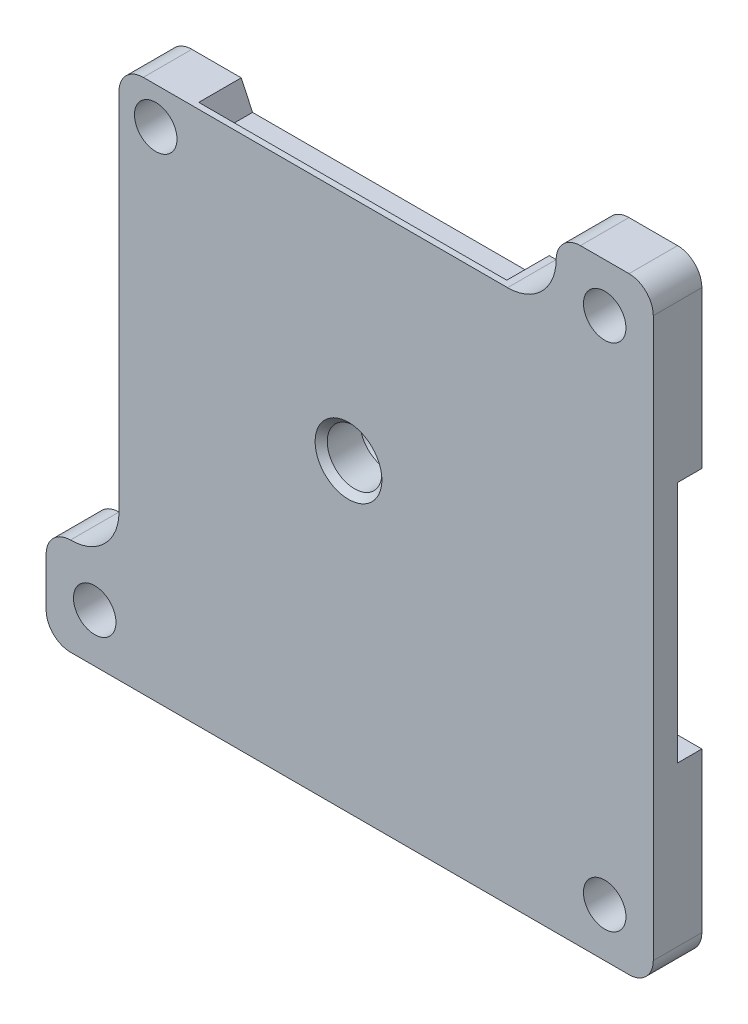
from build123d import *
from OCP.BRepFilletAPI import BRepFilletAPI_MakeChamfer

# Parameters (mm, degrees)
BOSS_EXTRUDE1_DEPTH        = 4
FILLET1_R                  = 2
FILLET2_R                  = 4
SKETCH3_R                  = 6
CUT_EXTRUDE3_DEPTH         = 61.942595941
SKETCH4_R                  = 1.75
CUT_EXTRUDE6_DEPTH         = 61.942595941
CUT_EXTRUDE7_DEPTH         = 10
CUT_EXTRUDE8_START         = -12.533
CUT_EXTRUDE8_DEPTH         = 25.3653
CHAMFER1_SIZE              = 2
CHAMFER1_SIZE_2            = 0.932615316
CHAMFER1_OF_MIRROR1_SIZE   = 0.932615316
CHAMFER1_OF_MIRROR1_SIZE_2 = 2
CHAMFER2_SIZE              = 0.5


with BuildPart() as part:
    # Sketch1 → Boss-Extrude1 (new body)
    with BuildSketch(Plane.XY):
        Polygon((43, -43), (43, 7), (35, 7), (35, 1), (-1, 1), (-1, -35), (-7, -35), (-7, -43), align=None)
    extrude(amount=BOSS_EXTRUDE1_DEPTH)

    # Fillet1
    fillet1_edges = [part.edges().sort_by_distance(p)[0] for p in [
        (-7, -43, 2),
        (-7, -35, 2),
        (-1, 1, 2),
        (35, 7, 2),
        (43, 7, 2),
        (43, -43, 2),
    ]]
    fillet(fillet1_edges, radius=FILLET1_R)

    # Fillet2
    fillet2_edges = [part.edges().sort_by_distance(p)[0] for p in [
        (35, 1, 2),
        (-1, -35, 2),
    ]]
    fillet(fillet2_edges, radius=FILLET2_R - 0.0001)  # a hair under: the kernel refuses the full size

    # Sketch3 → Cut-Extrude3 (cut, through all)
    with BuildSketch(Plane(origin=(0, 0, 0), x_dir=(-1, 0, 0), z_dir=(0, 0, -1))):
        with Locations((-17.899660586, -17.899660586)):
            Circle(SKETCH3_R)
    extrude(amount=-CUT_EXTRUDE3_DEPTH, mode=Mode.SUBTRACT)

    # Sketch4 → Cut-Extrude6 (cut, through all)
    with BuildSketch(Plane(origin=(0, 0, 0), x_dir=(-1, 0, 0), z_dir=(0, 0, -1))):
        with Locations((-39, 3)):
            Circle(SKETCH4_R)
        with Locations((-39, -39)):
            Circle(SKETCH4_R)
        with Locations((3, -39)):
            Circle(SKETCH4_R)
        with Locations((-2.025269256, -2.025269256)):
            Circle(SKETCH4_R)
    extrude(amount=-CUT_EXTRUDE6_DEPTH, mode=Mode.SUBTRACT)

    # Sketch5 → Cut-Extrude7 (cut, symmetric)
    with BuildSketch(Plane.ZY.offset(-17.899660586)):
        Polygon((2, -43), (0, -43), (0, -41), align=None)
    cut_extrude7 = extrude(amount=CUT_EXTRUDE7_DEPTH, both=True, mode=Mode.SUBTRACT)

    # Sketch6 → Cut-Extrude8 (cut)
    with BuildSketch(Plane.ZY.offset(-17.899660586).offset(CUT_EXTRUDE8_START)):
        Polygon((0, 1), (0, -1), (1.5, -1), (3.5, 1), align=None)
    cut_extrude8 = extrude(amount=CUT_EXTRUDE8_DEPTH, mode=Mode.SUBTRACT)

    # Chamfer1
    chamfer1_edges_1 = [part.edges().sort_by_distance(p)[0] for p in [
        (5.067360586, -1, 0.75),
    ]]
    chamfer1_side_1 = [part.faces().sort_by_distance(p)[0] for p in [
        (5.067360586, -0.981347694, 0.75),
    ]]
    chamfer1_edges_2 = [part.edges().sort_by_distance(p)[0] for p in [
        (30.432660586, -1, 0.75),
    ]]
    chamfer1_side_2 = [part.faces().sort_by_distance(p)[0] for p in [
        (30.41400828, -1, 0.75),
    ]]
    chamfer1 = BRepFilletAPI_MakeChamfer(part.part.solid().wrapped)
    for e in chamfer1_edges_1:
        chamfer1.Add(CHAMFER1_SIZE - 0.0001, CHAMFER1_SIZE_2 - 0.0001, e.wrapped, chamfer1_side_1[0].wrapped)
    for e in chamfer1_edges_2:
        chamfer1.Add(CHAMFER1_SIZE_2 - 0.0001, CHAMFER1_SIZE - 0.0001, e.wrapped, chamfer1_side_2[0].wrapped)
    add(Compound.cast(chamfer1.Shape()), mode=Mode.REPLACE)  # a hair under: the kernel refuses the full size

    # Mirror1: Cut-Extrude7, Cut-Extrude8 across plane
    add(cut_extrude7.mirror(Plane(origin=(0, 0, 0), x_dir=(0, 0, 1), z_dir=(-0.7071067811865479, -0.7071067811865472, 0))), mode=Mode.SUBTRACT)
    add(cut_extrude8.mirror(Plane(origin=(0, 0, 0), x_dir=(0, 0, 1), z_dir=(-0.7071067811865479, -0.7071067811865472, 0))), mode=Mode.SUBTRACT)

    # Chamfer1 of Mirror1
    chamfer1_of_mirror1_edges_1 = [part.edges().sort_by_distance(p)[0] for p in [
        (1, -5.067360586, 0.75),
    ]]
    chamfer1_of_mirror1_side_1 = [part.faces().sort_by_distance(p)[0] for p in [
        (1, -5.086012893, 0.75),
    ]]
    chamfer1_of_mirror1_edges_2 = [part.edges().sort_by_distance(p)[0] for p in [
        (1, -30.432660586, 0.75),
    ]]
    chamfer1_of_mirror1_side_2 = [part.faces().sort_by_distance(p)[0] for p in [
        (0.981347694, -30.432660586, 0.75),
    ]]
    chamfer1_of_mirror1 = BRepFilletAPI_MakeChamfer(part.part.solid().wrapped)
    for e in chamfer1_of_mirror1_edges_1:
        chamfer1_of_mirror1.Add(CHAMFER1_OF_MIRROR1_SIZE - 0.0001, CHAMFER1_OF_MIRROR1_SIZE_2 - 0.0001, e.wrapped, chamfer1_of_mirror1_side_1[0].wrapped)
    for e in chamfer1_of_mirror1_edges_2:
        chamfer1_of_mirror1.Add(CHAMFER1_OF_MIRROR1_SIZE_2 - 0.0001, CHAMFER1_OF_MIRROR1_SIZE - 0.0001, e.wrapped, chamfer1_of_mirror1_side_2[0].wrapped)
    add(Compound.cast(chamfer1_of_mirror1.Shape()), mode=Mode.REPLACE)  # a hair under: the kernel refuses the full size

    # Sketch7 → Revolve1 (revolve)
    with BuildSketch(Plane(origin=(0, -17.899660586, 0), x_dir=(0, 0, -1), z_dir=(0, -1, 0))):
        Polygon((0, 23.899660586), (5, 21.01290924), (5, 18.899660586), (1.365063509, 18.899660586), (-0.8, 20.149660586), (-4, 20.149660586), (-4, 23.899660586), align=None)
    revolve(axis=Axis((17.899660586, -17.899660586, 0), (0, 0, -1)))

    # Chamfer2
    chamfer2_edges = [part.edges().sort_by_distance(p)[0] for p in [
        (15.649660586, -17.899660586, 4),
    ]]
    chamfer(chamfer2_edges, length=CHAMFER2_SIZE)


solid = part.part
